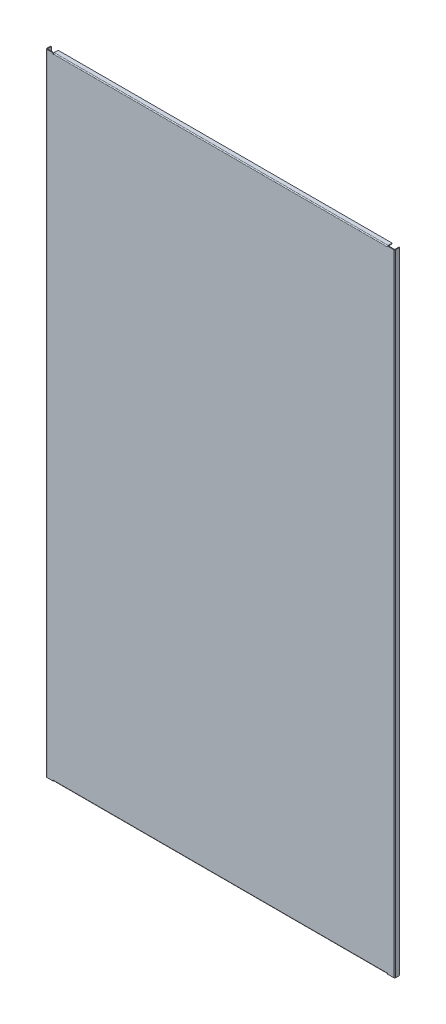
from build123d import *

# Parameters (mm, degrees)
SKETCH_1_W                          = 1077
SKETCH_1_H                          = 1947
SM_BASE_FLANGE_1_DEPTH              = 2
SM_EDGE_FLANGE_1_STRIP_W            = 9.5
SM_EDGE_FLANGE_1_STRIP_H            = 2
SM_EDGE_FLANGE_1_STRIP_CUT_DEPTH    = 1947
SM_EDGE_FLANGE_1_STRIP_2_W          = 9.5
SM_EDGE_FLANGE_1_STRIP_2_H          = 2
SM_EDGE_FLANGE_1_STRIP_CUT_2_DEPTH  = 1947
SM_EDGE_FLANGE_1_DEPTH              = 1947
SM_EDGE_FLANGE_1_BEND_DEPTH         = 1947
SM_EDGE_FLANGE_2_STRIP_W            = 9.5
SM_EDGE_FLANGE_2_STRIP_H            = 2
SM_EDGE_FLANGE_2_STRIP_CUT_DEPTH    = 1031.5
SM_EDGE_FLANGE_2_RELIEF_W           = 10.5
SM_EDGE_FLANGE_2_RELIEF_H           = 1
SM_EDGE_FLANGE_2_RELIEF_CUT_DEPTH   = 2
SM_EDGE_FLANGE_2_STRIP_2_W          = 9.5
SM_EDGE_FLANGE_2_STRIP_2_H          = 2
SM_EDGE_FLANGE_2_STRIP_CUT_2_DEPTH  = 1031.5
SM_EDGE_FLANGE_2_RELIEF_2_W         = 10.5
SM_EDGE_FLANGE_2_RELIEF_2_H         = 1
SM_EDGE_FLANGE_2_RELIEF_CUT_2_DEPTH = 2
SM_EDGE_FLANGE_2_DEPTH              = 1031.5
SM_EDGE_FLANGE_2_BEND_DEPTH         = 1031.5


# Sheet-metal steps are written as plain solids
with BuildPart() as part:
    # Sketch 1 → Базовая кромка1 (new body)
    with BuildSketch(Plane.XY):
        Rectangle(SKETCH_1_W, SKETCH_1_H)
    extrude(amount=SM_BASE_FLANGE_1_DEPTH)

    # Ребро-кромка1 strip (across the edge) → Ребро-кромка1 strip cut (cut)
    with BuildSketch(Plane(origin=(-538.5, -973.5, 0), x_dir=(1, 0, 0), z_dir=(0, 1, 0))):
        with Locations((-2, -1)):
            Rectangle(SM_EDGE_FLANGE_1_STRIP_W, SM_EDGE_FLANGE_1_STRIP_H)
    extrude(amount=SM_EDGE_FLANGE_1_STRIP_CUT_DEPTH, mode=Mode.SUBTRACT)

    # Ребро-кромка1 strip 2 (across the edge) → Ребро-кромка1 strip cut 2 (cut)
    with BuildSketch(Plane(origin=(538.5, 973.5, 0), x_dir=(-1, 0, 0), z_dir=(0, -1, 0))):
        with Locations((-2, -1)):
            Rectangle(SM_EDGE_FLANGE_1_STRIP_2_W, SM_EDGE_FLANGE_1_STRIP_2_H)
    extrude(amount=SM_EDGE_FLANGE_1_STRIP_CUT_2_DEPTH, mode=Mode.SUBTRACT)

    # Ребро-кромка1 section (across the edge) → Ребро-кромка1 (add)
    with BuildSketch(Plane(origin=(-538.5, -973.5, 0), x_dir=(1, 0, 0), z_dir=(0, 1, 0))):
        with BuildLine():
            Line((0, 0.75), (0, 13))
            Line((0, 13), (2, 13))
            Line((2, 13), (2, 0.75))
            ThreePointArc((2, 0.75), (2.219669914, 0.219669914), (2.75, 0))
            Line((2.75, 0), (2.75, -2))
            ThreePointArc((2.75, -2), (0.805456352, -1.194543648), (0, 0.75))
        make_face()
    extrude(amount=SM_EDGE_FLANGE_1_DEPTH)

    # Ребро-кромка1 section 2 (across the edge) → Ребро-кромка1 bend (add)
    with BuildSketch(Plane(origin=(538.5, 973.5, 0), x_dir=(-1, 0, 0), z_dir=(0, -1, 0))):
        with BuildLine():
            Line((0, 0.75), (0, 13))
            Line((0, 13), (2, 13))
            Line((2, 13), (2, 0.75))
            ThreePointArc((2, 0.75), (2.219669914, 0.219669914), (2.75, 0))
            Line((2.75, 0), (2.75, -2))
            ThreePointArc((2.75, -2), (0.805456352, -1.194543648), (0, 0.75))
        make_face()
    extrude(amount=SM_EDGE_FLANGE_1_BEND_DEPTH)

    # Ребро-кромка2 strip (across the edge) → Ребро-кромка2 strip cut (cut)
    with BuildSketch(Plane(origin=(-515.75, 973.5, 0), x_dir=(0, -1, 0), z_dir=(1, 0, 0))):
        with Locations((-2, -1)):
            Rectangle(SM_EDGE_FLANGE_2_STRIP_W, SM_EDGE_FLANGE_2_STRIP_H)
    extrude(amount=SM_EDGE_FLANGE_2_STRIP_CUT_DEPTH, mode=Mode.SUBTRACT)

    # Ребро-кромка2 relief (on the sheet) → Ребро-кромка2 relief cut (cut)
    with BuildSketch(Plane(origin=(-515.75, 970.75, 0), x_dir=(0, -1, 0), z_dir=(0, 0, -1))):
        with Locations((-4.25, 0.5)):
            Rectangle(SM_EDGE_FLANGE_2_RELIEF_W, SM_EDGE_FLANGE_2_RELIEF_H)
        with Locations((-4.25, -1032)):
            Rectangle(SM_EDGE_FLANGE_2_RELIEF_W, SM_EDGE_FLANGE_2_RELIEF_H)
    extrude(amount=-SM_EDGE_FLANGE_2_RELIEF_CUT_DEPTH, mode=Mode.SUBTRACT)

    # Ребро-кромка2 strip 2 (across the edge) → Ребро-кромка2 strip cut 2 (cut)
    with BuildSketch(Plane(origin=(515.75, -973.5, 0), x_dir=(0, 1, 0), z_dir=(-1, 0, 0))):
        with Locations((-2, -1)):
            Rectangle(SM_EDGE_FLANGE_2_STRIP_2_W, SM_EDGE_FLANGE_2_STRIP_2_H)
    extrude(amount=SM_EDGE_FLANGE_2_STRIP_CUT_2_DEPTH, mode=Mode.SUBTRACT)

    # Ребро-кромка2 relief 2 (on the sheet) → Ребро-кромка2 relief cut 2 (cut)
    with BuildSketch(Plane(origin=(515.75, -970.75, 0), x_dir=(0, 1, 0), z_dir=(0, 0, -1))):
        with Locations((-4.25, 0.5)):
            Rectangle(SM_EDGE_FLANGE_2_RELIEF_2_W, SM_EDGE_FLANGE_2_RELIEF_2_H)
        with Locations((-4.25, -1032)):
            Rectangle(SM_EDGE_FLANGE_2_RELIEF_2_W, SM_EDGE_FLANGE_2_RELIEF_2_H)
    extrude(amount=-SM_EDGE_FLANGE_2_RELIEF_CUT_2_DEPTH, mode=Mode.SUBTRACT)

    # Ребро-кромка2 section (across the edge) → Ребро-кромка2 (add)
    with BuildSketch(Plane(origin=(-515.75, 973.5, 0), x_dir=(0, -1, 0), z_dir=(1, 0, 0))):
        with BuildLine():
            Line((0, 0.75), (0, 13))
            Line((0, 13), (2, 13))
            Line((2, 13), (2, 0.75))
            ThreePointArc((2, 0.75), (2.219669914, 0.219669914), (2.75, 0))
            Line((2.75, 0), (2.75, -2))
            ThreePointArc((2.75, -2), (0.805456352, -1.194543648), (0, 0.75))
        make_face()
    extrude(amount=SM_EDGE_FLANGE_2_DEPTH)

    # Ребро-кромка2 section 2 (across the edge) → Ребро-кромка2 bend (add)
    with BuildSketch(Plane(origin=(515.75, -973.5, 0), x_dir=(0, 1, 0), z_dir=(-1, 0, 0))):
        with BuildLine():
            Line((0, 0.75), (0, 13))
            Line((0, 13), (2, 13))
            Line((2, 13), (2, 0.75))
            ThreePointArc((2, 0.75), (2.219669914, 0.219669914), (2.75, 0))
            Line((2.75, 0), (2.75, -2))
            ThreePointArc((2.75, -2), (0.805456352, -1.194543648), (0, 0.75))
        make_face()
    extrude(amount=SM_EDGE_FLANGE_2_BEND_DEPTH)


solid = part.part
